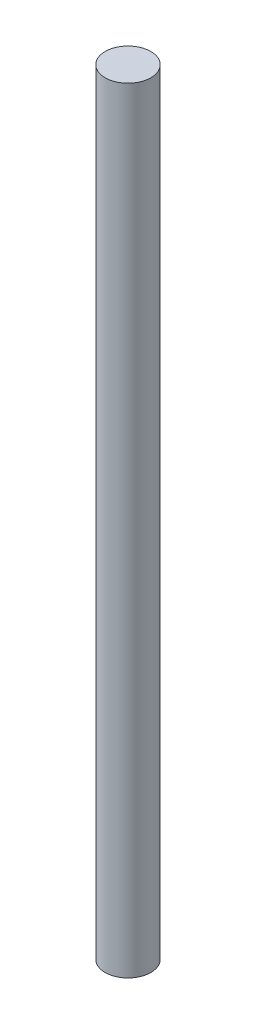
from build123d import *

# Parameters (mm, degrees)
SKETCH3_R           = 5.005
BOSS_EXTRUDE1_DEPTH = 170


with BuildPart() as part:
    # Sketch3 → Boss-Extrude1 (new body)
    with BuildSketch(Plane(origin=(0, 0, 0), x_dir=(1, 0, 0), z_dir=(0, 1, 0))):
        Circle(SKETCH3_R)
    extrude(amount=BOSS_EXTRUDE1_DEPTH)


solid = part.part
